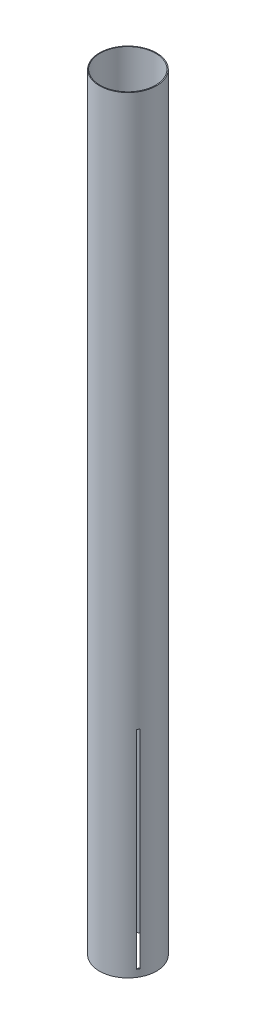
from build123d import *

# Parameters (mm, degrees)
SKETCH1_R           = 51
SKETCH1_R_2         = 49.55
BOSS_EXTRUDE1_DEPTH = 1370
CUT_EXTRUDE1_DEPTH  = 1372.897226471
CIRPATTERN1_COUNT   = 3


with BuildPart() as part:
    # Sketch1 → Boss-Extrude1 (new body)
    with BuildSketch(Plane(origin=(0, 0, 0), x_dir=(1, 0, 0), z_dir=(0, 1, 0))):
        Circle(SKETCH1_R)
        with Locations((-0.342312985, 0)):
            Circle(SKETCH1_R_2, mode=Mode.SUBTRACT)
    extrude(amount=BOSS_EXTRUDE1_DEPTH)

    # Sketch2 → Cut-Extrude1 (cut, through all)
    with BuildSketch(Plane.XY):
        Polygon((0, 12.7), (2.38, 12.7), (2.38, 383.7), (-2.38, 383.7), (-2.38, 12.7), align=None)
    cut_extrude1 = extrude(amount=-CUT_EXTRUDE1_DEPTH, mode=Mode.SUBTRACT)

    # CirPattern1: Cut-Extrude1 ×3 about axis
    cirpattern1_axis = Axis((0, 0, 0), (0, 1, 0))
    for i in range(1, CIRPATTERN1_COUNT):
        add(cut_extrude1.rotate(cirpattern1_axis, i * 360 / CIRPATTERN1_COUNT), mode=Mode.SUBTRACT)


solid = part.part
